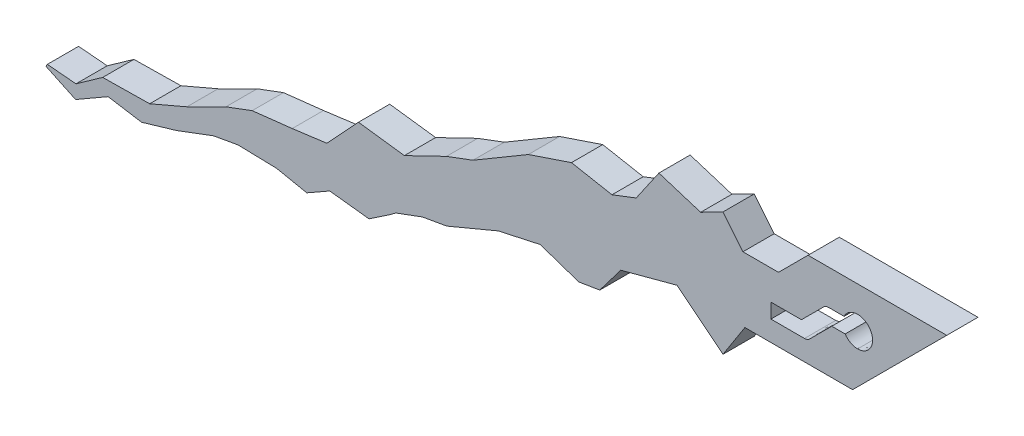
from build123d import *

# Parameters (mm, degrees)
AUFSATZ_LINEAR_AUSTRAGEN1_DEPTH = 3


with BuildPart() as part:
    # Model → Aufsatz-Linear austragen1 (new body)
    with BuildSketch(Plane.XY):
        Polygon((73.302351037, 22.326193), (70.466898037, 19.49019), (67.052232348, 19.49019), (65.137681317, 21.845430365), (62.991032211, 20.74255357), (58.98408411, 22.002723395), (56.803025277, 18.838799987), (54.479472638, 17.944387552), (50.590045162, 18.671311469), (46.453571197, 17.279001849), (41.13411009, 14.142871548), (38.589731327, 13.192798765), (34.547624577, 11.233833158), (30.138450772, 11.805961103), (27.107969746, 8.540928475), (23.780045408, 8.100067659), (19.936127351, 7.66478422), (17.412051541, 6.721745518), (13.666478389, 4.851439522), (10.094159276, 3.31838603), (5.581557396, 3.252403134), (3.018679888, 1.437789494), (0.267615815, 1.681686606), (0.139255665, 1.450036519), (2.981259207, 0.112717707), (6.103802629, 1.911840243), (9.316252439, 1.390544324), (12.654978949, 2.37525976), (16.220528303, 3.71668742), (18.592172458, 4.136226415), (22.278781518, 4.040375996), (25.17854953, 3.45136198), (27.378099305, 4.707929746), (31.154158786, 4.275155188), (33.12012363, 5.602791174), (33.743945522, 6.059175301), (36.273487133, 6.993162332), (38.623930322, 7.40950148), (43.568122132, 9.480735691), (47.587850926, 10.360103552), (51.289745245, 9.10021528), (53.306429574, 9.430362647), (55.321012535, 12.093178428), (60.730020191, 13.5422594), (65.139915376, 10.008236064), (67.241328121, 13.286723), (77.58071665, 13.286723), (86.620188607, 22.326193), align=None)
        with BuildLine():
            Line((76.864216, 17.563371), (75.579887, 17.563371))
            Line((75.579887, 17.563371), (73.461014, 15.444501))
            add(Edge.make_bspline(
                [(73.461014, 15.444501), (73.328713, 15.312184), (73.149277, 15.237832), (72.962166, 15.237795)],
                knots=[0, 0, 0, 0, 1, 1, 1, 1], degree=3))
            Line((72.962166, 15.237795), (69.738658, 15.237795))
            Line((69.738658, 15.237795), (69.738658, 16.648907))
            Line((69.738658, 16.648907), (72.670021, 16.648907))
            Line((72.670021, 16.648907), (74.788889, 18.767777))
            add(Edge.make_bspline(
                [(74.788889, 18.767777), (74.921189, 18.900094), (75.100629, 18.974446), (75.287742, 18.974483)],
                knots=[0, 0, 0, 0, 1, 1, 1, 1], degree=3))
            Line((75.287742, 18.974483), (76.763347, 18.974483))
            add(Edge.make_bspline(
                [(76.763347, 18.974483), (77.001082, 19.476488), (77.506556, 19.796808), (78.062006, 19.797448)],
                knots=[0, 0, 0, 0, 1, 1, 1, 1], degree=3))
            add(Edge.make_bspline(
                [(78.062006, 19.797448), (78.856544, 19.797397), (79.500628, 19.15331), (79.500679, 18.358775)],
                knots=[0, 0, 0, 0, 1, 1, 1, 1], degree=3))
            add(Edge.make_bspline(
                [(79.500679, 18.358775), (79.500628, 17.564241), (78.856544, 16.920153), (78.062006, 16.920102)],
                knots=[0, 0, 0, 0, 1, 1, 1, 1], degree=3))
            add(Edge.make_bspline(
                [(78.062006, 16.920102), (77.580228, 16.920385), (77.130597, 17.161927), (76.864216, 17.563371)],
                knots=[0, 0, 0, 0, 1, 1, 1, 1], degree=3))
        make_face(mode=Mode.SUBTRACT)
    extrude(amount=AUFSATZ_LINEAR_AUSTRAGEN1_DEPTH)


solid = part.part
